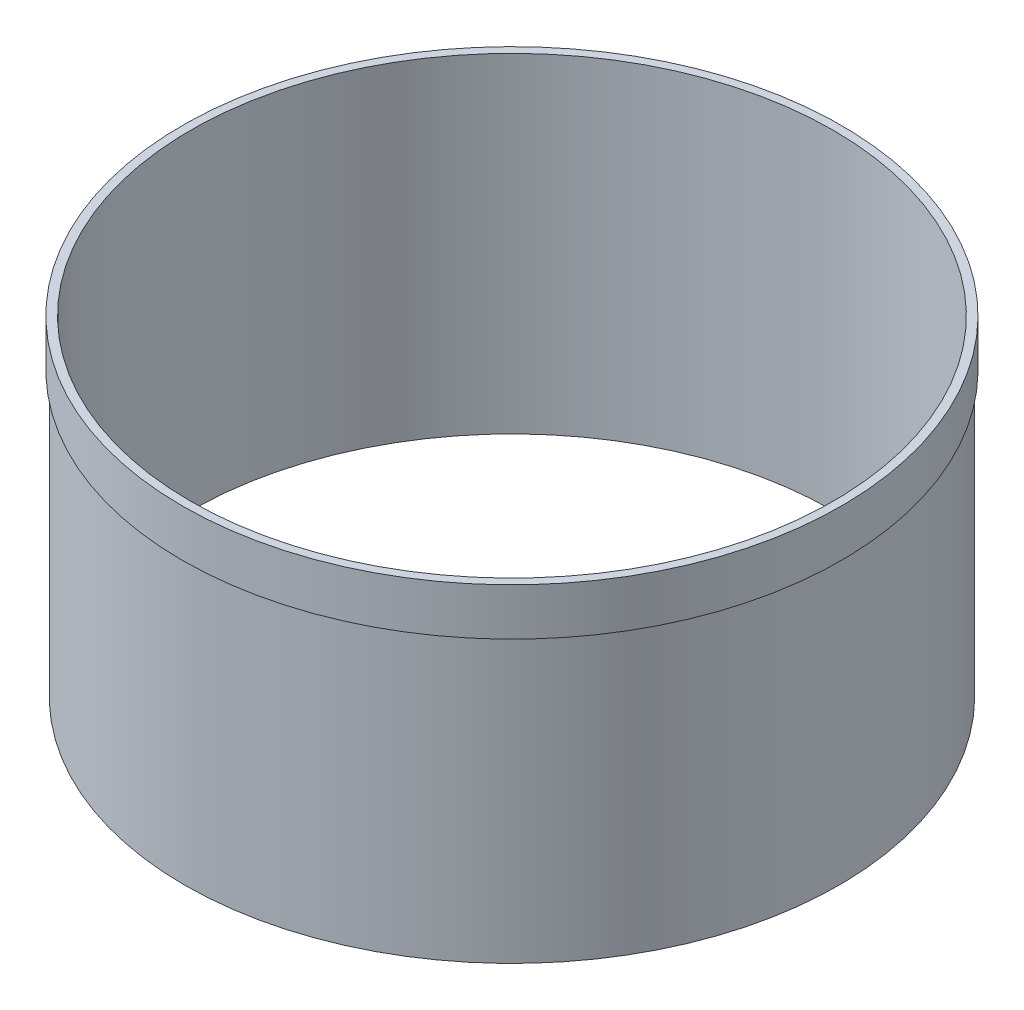
from build123d import *

# Parameters (mm, degrees)
SKETCH1_R           = 88.265
SKETCH1_R_2         = 86.6775
BOSS_EXTRUDE1_DEPTH = 88.9
BOSS_EXTRUDE2_START = -12.7
SKETCH2_R           = 88.9
SKETCH2_R_2         = 88.265
BOSS_EXTRUDE2_DEPTH = 12.7


with BuildPart() as part:
    # Sketch1 → Boss-Extrude1 (new body)
    with BuildSketch(Plane(origin=(0, 0, 0), x_dir=(1, 0, 0), z_dir=(0, 1, 0))):
        Circle(SKETCH1_R)
        Circle(SKETCH1_R_2, mode=Mode.SUBTRACT)
    extrude(amount=BOSS_EXTRUDE1_DEPTH)

    # Sketch2 → Boss-Extrude2 (add)
    with BuildSketch(Plane(origin=(0, 88.9, 0), x_dir=(1, 0, 0), z_dir=(0, 1, 0)).offset(BOSS_EXTRUDE2_START)):
        Circle(SKETCH2_R)
        Circle(SKETCH2_R_2, mode=Mode.SUBTRACT)
    extrude(amount=BOSS_EXTRUDE2_DEPTH)


solid = part.part
